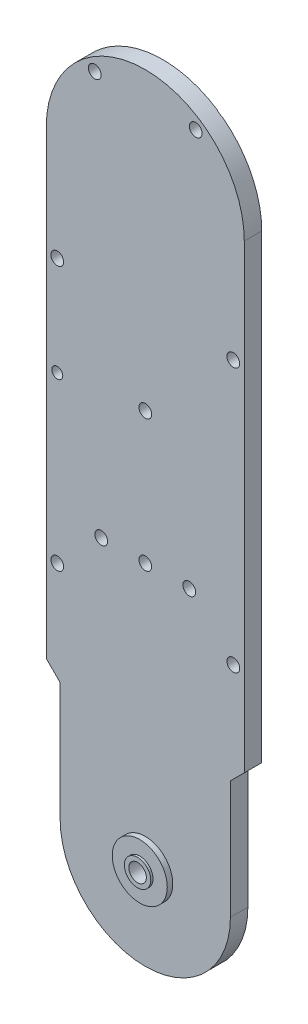
from build123d import *

# Parameters (mm, degrees)
SKETCH1_R                                       = 4
SKETCH1_R_2                                     = 2.5
BOSS_EXTRUDE1_DEPTH                             = 7.9375
SKETCH3_R                                       = 12.5
SKETCH3_R_2                                     = 4
BOSS_EXTRUDE2_DEPTH                             = 5
CUT_EXTRUDE1_START                              = -2.5
SKETCH4_R                                       = 12.5
SKETCH4_R_2                                     = 6
CUT_EXTRUDE1_DEPTH                              = 2.5
CHAMFER1_SIZE                                   = 10
CUT_EXTRUDE2_START                              = -1.5
SKETCH5_R                                       = 6
CUT_EXTRUDE2_DEPTH                              = 1.5
CSK_FOR_M5_OVAL_HEAD_MACHINE_SCREW2_D           = 5.8
CSK_FOR_M5_OVAL_HEAD_MACHINE_SCREW2_CSINK_D     = 10.4
CSK_FOR_M5_OVAL_HEAD_MACHINE_SCREW2_CSINK_ANGLE = 90
CSK_FOR_M5_OVAL_HEAD_MACHINE_SCREW3_D           = 5.8
CSK_FOR_M5_OVAL_HEAD_MACHINE_SCREW3_CSINK_D     = 10.4
CSK_FOR_M5_OVAL_HEAD_MACHINE_SCREW3_CSINK_ANGLE = 90


with BuildPart() as part:
    # Sketch1 → Boss-Extrude1 (new body)
    with BuildSketch(Plane.XY):
        with BuildLine():
            Line((-45, 0), (-45, -65.863068229))
            Line((-45, -65.863068229), (-45, -72.736931771))
            Line((-45, -72.736931771), (-45, -165.863068229))
            Line((-45, -165.863068229), (-45, -172.736931771))
            Line((-45, -172.736931771), (-45, -219.3))
            Line((-45, -219.3), (-38.7, -219.3))
            Line((-38.7, -219.3), (-38.7, -269.3))
            ThreePointArc((-38.7, -269.3), (0, -308), (38.7, -269.3))
            Line((38.7, -269.3), (38.7, -219.3))
            Line((38.7, -219.3), (45, -219.3))
            Line((45, -219.3), (45, -172.736931771))
            Line((45, -172.736931771), (45, -165.863068229))
            Line((45, -165.863068229), (45, -72.736931771))
            Line((45, -72.736931771), (45, -65.863068229))
            Line((45, -65.863068229), (45, 0))
            ThreePointArc((45, 0), (0, 45), (-45, 0))
        make_face()
        with Locations((0, -269.3)):
            Circle(SKETCH1_R, mode=Mode.SUBTRACT)
        with Locations((0, -89.3)):
            Circle(SKETCH1_R_2, mode=Mode.SUBTRACT)
        with Locations((0, -149.3)):
            Circle(SKETCH1_R_2, mode=Mode.SUBTRACT)
        with Locations((20, -149.3)):
            Circle(SKETCH1_R_2, mode=Mode.SUBTRACT)
        with Locations(Location((-20, -149.3, 0), (0, 0, 180))):
            Circle(SKETCH1_R_2, mode=Mode.SUBTRACT)
        with Locations((-40, -49.3)):
            Circle(SKETCH1_R_2, mode=Mode.SUBTRACT)
        with Locations((-40, -169.3)):
            Circle(SKETCH1_R_2, mode=Mode.SUBTRACT)
        with Locations(Location((40, -169.3, 0), (0, 0, 180))):
            Circle(SKETCH1_R_2, mode=Mode.SUBTRACT)
        with Locations(Location((40, -49.3, 0), (0, 0, 180))):
            Circle(SKETCH1_R_2, mode=Mode.SUBTRACT)
        with Locations((-22.943057454, 32.766081772)):
            Circle(SKETCH1_R_2, mode=Mode.SUBTRACT)
        with Locations((22.943057454, 32.766081772)):
            Circle(SKETCH1_R_2, mode=Mode.SUBTRACT)
        with Locations((-40, -94.3)):
            Circle(SKETCH1_R_2, mode=Mode.SUBTRACT)
    extrude(amount=BOSS_EXTRUDE1_DEPTH)

    # Sketch3 → Boss-Extrude2 (add)
    with BuildSketch(Plane.XY.offset(7.9375)):
        with Locations(Location((0, -269.3, 0), (0, 0, 180))):
            Circle(SKETCH3_R)
        with Locations((0, -269.3)):
            Circle(SKETCH3_R_2, mode=Mode.SUBTRACT)
    extrude(amount=BOSS_EXTRUDE2_DEPTH)

    # Sketch4 → Cut-Extrude1 (cut)
    with BuildSketch(Plane.XY.offset(12.9375).offset(CUT_EXTRUDE1_START)):
        with Locations(Location((0, -269.3, 0), (0, 0, 180))):
            Circle(SKETCH4_R)
        with Locations((0, -269.3)):
            Circle(SKETCH4_R_2, mode=Mode.SUBTRACT)
    extrude(amount=CUT_EXTRUDE1_DEPTH, mode=Mode.SUBTRACT)

    # Chamfer1
    # the kernel refuses this chamfer: 10 mm, written as the material it takes off along each edge
    with BuildSketch(Plane(origin=(45, -219.3, -25.71682988), x_dir=(0.027495876610586282, 0.9996219169112968, 0), z_dir=(0, 0, 1))) as chamfer1_piece_1_section:
        Polygon((CHAMFER1_SIZE * 0.999621916911, CHAMFER1_SIZE * 0.0274958766106), (-CHAMFER1_SIZE * 0.0274958766106, CHAMFER1_SIZE * 0.999621916911), (0, 0), align=None)
    chamfer1_piece_1 = extrude(amount=59.371159759, mode=Mode.PRIVATE)
    chamfer1_piece_1 = split(chamfer1_piece_1, bisect_by=Plane(origin=(38.7, -215.600664049, 3.96875), z_dir=(1, 0, 0)), keep=Keep.TOP, mode=Mode.PRIVATE)
    add(chamfer1_piece_1, mode=Mode.SUBTRACT)
    with BuildSketch(Plane(origin=(-45, -219.3, -25.71682988), x_dir=(-0.027495876610586282, 0.9996219169112968, 0), z_dir=(0, 0, 1))) as chamfer1_piece_2_section:
        Polygon((CHAMFER1_SIZE * 0.999621916911, -CHAMFER1_SIZE * 0.0274958766106), (-CHAMFER1_SIZE * 0.0274958766106, -CHAMFER1_SIZE * 0.999621916911), (0, 0), align=None)
    chamfer1_piece_2 = extrude(amount=59.371159759, mode=Mode.PRIVATE)
    chamfer1_piece_2 = split(chamfer1_piece_2, bisect_by=Plane(origin=(-38.7, -215.600664049, 3.96875), z_dir=(-1, 0, 0)), keep=Keep.TOP, mode=Mode.PRIVATE)
    add(chamfer1_piece_2, mode=Mode.SUBTRACT)

    # Sketch5 → Cut-Extrude2 (cut)
    with BuildSketch(Plane.XY.offset(12.9375).offset(CUT_EXTRUDE2_START)):
        with Locations((0, -269.3)):
            Circle(SKETCH5_R)
    extrude(amount=CUT_EXTRUDE2_DEPTH, mode=Mode.SUBTRACT)

    # CSK for M5 Oval Head Machine Screw2 (through all)
    with Locations(Plane(origin=(40, -49.3, 0), x_dir=(-1, 0, 0), z_dir=(0, 0, -1))):
        with Locations((0, 0), (40, -40), (80, 0), (80, -120), (60, -100), (40, -100), (20, -100), (0, -120)):
            CounterSinkHole(CSK_FOR_M5_OVAL_HEAD_MACHINE_SCREW2_D / 2, CSK_FOR_M5_OVAL_HEAD_MACHINE_SCREW2_CSINK_D / 2, counter_sink_angle=CSK_FOR_M5_OVAL_HEAD_MACHINE_SCREW2_CSINK_ANGLE)

    # CSK for M5 Oval Head Machine Screw3 (through all)
    with Locations(Plane(origin=(22.943057454, 32.766081772, 0), x_dir=(-1, 0, 0), z_dir=(0, 0, -1))):
        with Locations((0, 0), (45.886114908, 0)):
            CounterSinkHole(CSK_FOR_M5_OVAL_HEAD_MACHINE_SCREW3_D / 2, CSK_FOR_M5_OVAL_HEAD_MACHINE_SCREW3_CSINK_D / 2, counter_sink_angle=CSK_FOR_M5_OVAL_HEAD_MACHINE_SCREW3_CSINK_ANGLE)


solid = part.part
